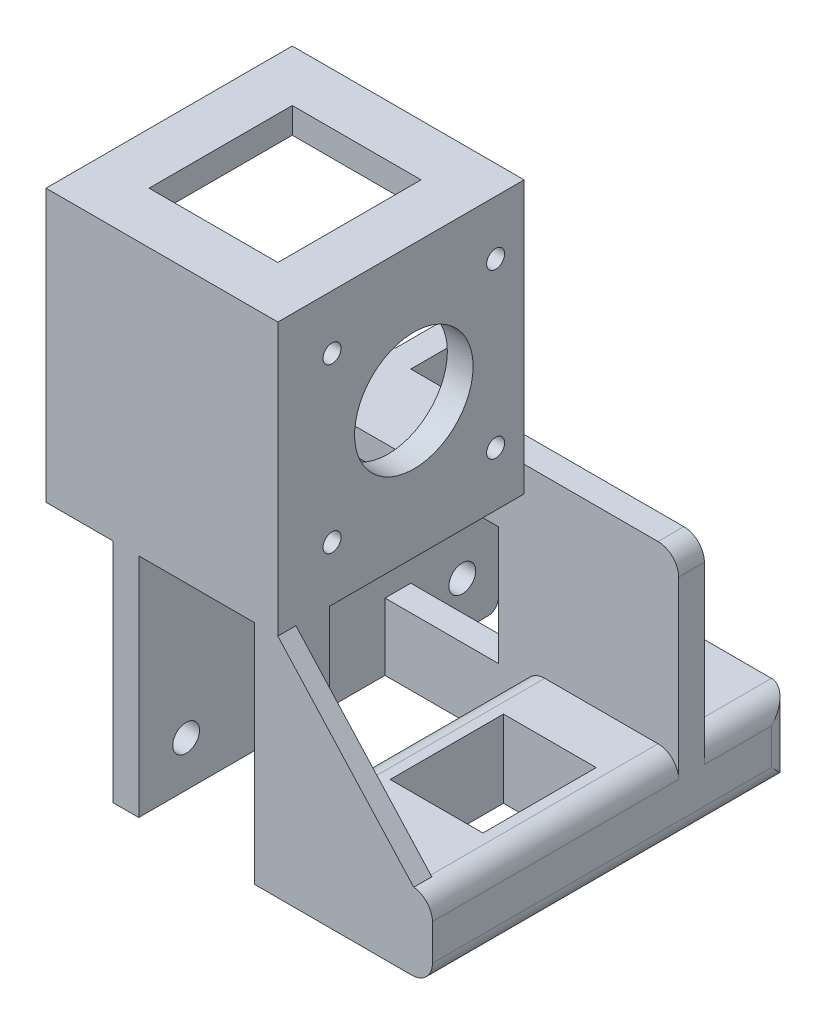
from build123d import *

# Parameters (mm, degrees)
SKETCH1_R            = 11
BOSS_EXTRUDE1_DEPTH  = 3
SKETCH2_R            = 5.25
CUT_EXTRUDE1_DEPTH   = 16.842979518
SKETCH3_R            = 1.5
SKETCH3_R_2          = 1.545696852
CUT_EXTRUDE2_DEPTH   = 16.842979518
SKETCH4_W            = 27.859055967
SKETCH4_H            = 2.012088195
BOSS_EXTRUDE3_DEPTH  = 11
SKETCH5_R            = 5.25
CUT_EXTRUDE3_DEPTH   = 31.019585245
SKETCH6_R            = 1.5
SKETCH6_R_2          = 1.545696852
CUT_EXTRUDE4_DEPTH   = 31.101943449
CUT_EXTRUDE5_DEPTH   = 10
BOSS_EXTRUDE5_START  = 5
SKETCH10_R           = 1.5
SKETCH10_R_2         = 5.25
SKETCH10_R_3         = 1.545696852
BOSS_EXTRUDE5_DEPTH  = 5
SKETCH11_W           = 18
SKETCH11_H           = 7.012088195
BOSS_EXTRUDE7_DEPTH  = 13
SKETCH13_W           = 6
SKETCH13_H           = 8
BOSS_EXTRUDE8_DEPTH  = 10
SKETCH14_W           = 18
SKETCH14_H           = 1.5
CUT_EXTRUDE6_DEPTH   = 10
SKETCH15_W           = 8
SKETCH15_H           = 8
BOSS_EXTRUDE9_DEPTH  = 30
SKETCH16_W           = 2
SKETCH16_H           = 8
BOSS_EXTRUDE10_DEPTH = 10
SKETCH18_W           = 47.012088195
SKETCH18_H           = 3.5
BOSS_EXTRUDE11_DEPTH = 8
SKETCH19_W           = 47.012088195
SKETCH19_H           = 5
BOSS_EXTRUDE12_DEPTH = 8
SKETCH20_R           = 2.75
CUT_EXTRUDE7_DEPTH   = 8
SKETCH21_W           = 30
SKETCH21_H           = 16.5
CUT_EXTRUDE8_DEPTH   = 8
BOSS_EXTRUDE13_DEPTH = 2
FILLET4_R            = 2
SKETCH24_W           = 18
SKETCH24_H           = 7.012088195
BOSS_EXTRUDE14_DEPTH = 13.5
SKETCH25_W           = 10.228009428
SKETCH25_H           = 18.5
BOSS_EXTRUDE15_DEPTH = 8
SKETCH26_R           = 2.6
CUT_EXTRUDE9_DEPTH   = 8
FILLET6_R            = 2
SKETCH27_W           = 8.492399871
SKETCH27_H           = 8.837619377
BOSS_EXTRUDE16_DEPTH = 8
SKETCH28_W           = 9.389970589
SKETCH28_H           = 7.249609645
BOSS_EXTRUDE17_DEPTH = 8
SKETCH30_W           = 8
SKETCH30_H           = 2
BOSS_EXTRUDE19_DEPTH = 8
SKETCH31_W           = 8
SKETCH31_H           = 2
BOSS_EXTRUDE20_DEPTH = 8
SKETCH32_W           = 8
SKETCH32_H           = 18.5
BOSS_EXTRUDE22_DEPTH = 5
SKETCH33_W           = 8
SKETCH33_H           = 18.5
BOSS_EXTRUDE23_DEPTH = 5
SKETCH34_R           = 2.6
CUT_EXTRUDE11_DEPTH  = 46.033658305
SKETCH35_R           = 2.6
CUT_EXTRUDE12_DEPTH  = 46.033658305
SKETCH36_W           = 8
SKETCH36_H           = 0.228009428
CUT_EXTRUDE13_DEPTH  = 57.389541409
SKETCH37_W           = 3
SKETCH37_H           = 18.5
CUT_EXTRUDE14_DEPTH  = 15
SKETCH38_W           = 3
SKETCH38_H           = 18.5
CUT_EXTRUDE15_DEPTH  = 15
FILLET9_R            = 2
SKETCH39_W           = 8.423355969
SKETCH39_H           = 9.735190095
SKETCH39_W_2         = 8.630487673
SKETCH39_H_2         = 8.354312067
BOSS_EXTRUDE24_DEPTH = 8
SKETCH40_R           = 2.6
CUT_EXTRUDE16_DEPTH  = 8
SKETCH41_W           = 3
SKETCH41_H           = 9.735190095
CUT_EXTRUDE18_DEPTH  = 9
SKETCH42_W           = 3
SKETCH42_H           = 8.354312067
CUT_EXTRUDE19_DEPTH  = 9
SKETCH43_R           = 2.6
CUT_EXTRUDE20_DEPTH  = 9
SKETCH48_W           = 22
SKETCH48_H           = 13
BOSS_EXTRUDE26_DEPTH = 5
SKETCH49_W           = 22
SKETCH49_H           = 13
BOSS_EXTRUDE27_DEPTH = 5
SKETCH50_W           = 5
SKETCH50_H           = 49
BOSS_EXTRUDE28_DEPTH = 15
SKETCH51_W           = 55
SKETCH51_H           = 5
BOSS_EXTRUDE29_DEPTH = 42.8
SKETCH52_W           = 55
SKETCH52_H           = 5
BOSS_EXTRUDE30_DEPTH = 47.8
SKETCH53_W           = 55
SKETCH53_H           = 5
BOSS_EXTRUDE31_DEPTH = 47.8
SKETCH55_W           = 15
SKETCH55_H           = 47.8
CUT_EXTRUDE21_DEPTH  = 128.298389621
SKETCH57_W           = 47.8
SKETCH57_H           = 52.8
BOSS_EXTRUDE32_DEPTH = 5
SKETCH58_R           = 11.5
CUT_EXTRUDE25_DEPTH  = 111.385370407
SKETCH61_W           = 25
SKETCH61_H           = 27.8
CUT_EXTRUDE26_DEPTH  = 128.298389621
SKETCH62_R           = 1.75
CUT_EXTRUDE28_DEPTH  = 108.656537191
SKETCH63_R           = 1.75
CUT_EXTRUDE29_DEPTH  = 108.656537191
SKETCH64_R           = 1.75
CUT_EXTRUDE30_DEPTH  = 108.656537191
SKETCH65_R           = 1.75
CUT_EXTRUDE31_DEPTH  = 108.656537191
SKETCH67_W           = 5
SKETCH67_H           = 49
BOSS_EXTRUDE33_DEPTH = 5
SKETCH68_W           = 15
SKETCH68_H           = 17.012088195
SKETCH68_H_2         = 47.8
BOSS_EXTRUDE34_DEPTH = 15
BOSS_EXTRUDE36_DEPTH = 15
SKETCH70_R           = 4.1
CUT_EXTRUDE32_DEPTH  = 10
SKETCH72_W           = 18
SKETCH72_H           = 22
CUT_EXTRUDE33_DEPTH  = 139.003188369
FILLET10_R           = 4
FILLET12_R           = 4
FILLET13_R           = 4
SKETCH74_W           = 4.5
SKETCH74_H           = 10
BOSS_EXTRUDE37_DEPTH = 50
SKETCH75_W           = 4.5
SKETCH75_H           = 10
BOSS_EXTRUDE38_DEPTH = 44.5
SKETCH76_W           = 10
SKETCH76_H           = 3.934778724
BOSS_EXTRUDE39_DEPTH = 14.5
SKETCH77_W           = 10
SKETCH77_H           = 4.5
BOSS_EXTRUDE42_DEPTH = 10
SKETCH78_W           = 10
SKETCH78_H           = 0.5
CUT_EXTRUDE34_DEPTH  = 10
BOSS_EXTRUDE43_DEPTH = 3.5
SKETCH81_W           = 5
SKETCH81_H           = 44
BOSS_EXTRUDE44_DEPTH = 47.8
SKETCH82_R           = 2.6
CUT_EXTRUDE36_DEPTH  = 7.8
SKETCH85_W           = 10
SKETCH85_H           = 44
CUT_EXTRUDE37_DEPTH  = 17.8
SKETCH90_W           = 6.956243517
SKETCH90_H           = 8.865800562
BOSS_EXTRUDE48_DEPTH = 5
SKETCH91_W           = 6.274258859
SKETCH91_H           = 6.956243518
SKETCH91_W_2         = 10.229769878
SKETCH91_H_2         = 10.502563742
SKETCH91_H_3         = 7.774625108
BOSS_EXTRUDE50_DEPTH = 5
SKETCH95_R           = 1.75
CUT_EXTRUDE41_DEPTH  = 5
SKETCH100_R          = 1.75
CUT_EXTRUDE42_DEPTH  = 5
SKETCH101_R          = 1.75
CUT_EXTRUDE43_DEPTH  = 5
SKETCH102_R          = 1.75
CUT_EXTRUDE44_DEPTH  = 5


with BuildPart() as part:
    # Sketch1 → Boss-Extrude1 (new body)
    with BuildSketch(Plane.XY):
        Circle(SKETCH1_R)
    extrude(amount=BOSS_EXTRUDE1_DEPTH)

    # Sketch2 → Cut-Extrude1 (cut, through all)
    with BuildSketch(Plane.XY.offset(3)):
        Circle(SKETCH2_R)
    extrude(amount=-CUT_EXTRUDE1_DEPTH, mode=Mode.SUBTRACT)

    # Sketch3 → Cut-Extrude2 (cut, through all)
    with BuildSketch(Plane.XY.offset(3)):
        with Locations((0, 8.5)):
            Circle(SKETCH3_R)
        with Locations((-8.5, 0)):
            Circle(SKETCH3_R)
        with Locations((0, -8.5)):
            Circle(SKETCH3_R_2)
        with Locations((8.5, 0)):
            Circle(SKETCH3_R)
    extrude(amount=-CUT_EXTRUDE2_DEPTH, mode=Mode.SUBTRACT)

    # Sketch4 → Boss-Extrude3 (add, symmetric)
    with BuildSketch(Plane(origin=(0, 0, 0), x_dir=(1, 0, 0), z_dir=(0, 1, 0))):
        with Locations((13.929527984, -1.993955902)):
            Rectangle(SKETCH4_W, SKETCH4_H)
    extrude(amount=BOSS_EXTRUDE3_DEPTH, both=True)

    # Sketch5 → Cut-Extrude3 (cut, through all)
    with BuildSketch(Plane(origin=(0, 0, 0.987911805), x_dir=(-1, 0, 0), z_dir=(0, 0, -1))):
        with Locations(Location((0, 0, 0), (0, 0, 180))):
            Circle(SKETCH5_R)
    extrude(amount=-CUT_EXTRUDE3_DEPTH, mode=Mode.SUBTRACT)

    # Sketch6 → Cut-Extrude4 (cut, through all)
    with BuildSketch(Plane(origin=(0, 0, 0), x_dir=(-1, 0, 0), z_dir=(0, 0, -1))):
        with Locations(Location((-8.5, 0, 0), (0, 0, 180))):
            Circle(SKETCH6_R)
        with Locations(Location((0, 8.5, 0), (0, 0, 180))):
            Circle(SKETCH6_R)
        with Locations(Location((0, -8.5, 0), (0, 0, 180))):
            Circle(SKETCH6_R_2)
    extrude(amount=-CUT_EXTRUDE4_DEPTH, mode=Mode.SUBTRACT)

    # Sketch7 → Cut-Extrude5 (cut)
    with BuildSketch(Plane(origin=(0, 0, 0.987911805), x_dir=(-1, 0, 0), z_dir=(0, 0, -1))):
        Polygon((-24, 11), (-27.859055967, 11), (-27.859055967, -11), (-24, -11), (-24, 0), align=None)
    extrude(amount=-CUT_EXTRUDE5_DEPTH, mode=Mode.SUBTRACT)

    # Sketch10 → Boss-Extrude5 (add)
    with BuildSketch(Plane.XY.offset(3).offset(BOSS_EXTRUDE5_START)):
        with BuildLine():
            Line((0, -11), (24, -11))
            Line((24, -11), (24, 11))
            Line((24, 11), (0, 11))
            ThreePointArc((0, 11), (-11, 0), (0, -11))
        make_face()
        with Locations((0, 8.5)):
            Circle(SKETCH10_R, mode=Mode.SUBTRACT)
        Circle(SKETCH10_R_2, mode=Mode.SUBTRACT)
        with Locations((0, -8.5)):
            Circle(SKETCH10_R_3, mode=Mode.SUBTRACT)
        with Locations((8.5, 0)):
            Circle(SKETCH10_R, mode=Mode.SUBTRACT)
        with Locations((-8.5, 0)):
            Circle(SKETCH10_R, mode=Mode.SUBTRACT)
    extrude(amount=-BOSS_EXTRUDE5_DEPTH)

    # Sketch11 → Boss-Extrude7 (add)
    with BuildSketch(Plane.XZ.offset(11)):
        with Locations((15, 4.493955902)):
            Rectangle(SKETCH11_W, SKETCH11_H)
    extrude(amount=BOSS_EXTRUDE7_DEPTH)

    # Sketch13 → Boss-Extrude8 (add)
    with BuildSketch(Plane(origin=(0, 0, 0.987911805), x_dir=(-1, 0, 0), z_dir=(0, 0, -1))):
        with Locations((-21, -18.5)):
            Rectangle(SKETCH13_W, SKETCH13_H)
    extrude(amount=BOSS_EXTRUDE8_DEPTH)

    # Sketch14 → Cut-Extrude6 (cut)
    with BuildSketch(Plane(origin=(0, 0, 0.987911805), x_dir=(-1, 0, 0), z_dir=(0, 0, -1))):
        with Locations((-15, -23.25)):
            Rectangle(SKETCH14_W, SKETCH14_H)
    extrude(amount=-CUT_EXTRUDE6_DEPTH, mode=Mode.SUBTRACT)

    # Sketch15 → Boss-Extrude9 (add)
    with BuildSketch(Plane.XY.offset(8)):
        with Locations((20, -18.5)):
            Rectangle(SKETCH15_W, SKETCH15_H)
    extrude(amount=BOSS_EXTRUDE9_DEPTH)

    # Sketch16 → Boss-Extrude10 (add)
    with BuildSketch(Plane(origin=(0, 0, 0.987911805), x_dir=(-1, 0, 0), z_dir=(0, 0, -1))):
        with Locations((-17, -18.5)):
            Rectangle(SKETCH16_W, SKETCH16_H)
    extrude(amount=BOSS_EXTRUDE10_DEPTH)

    # Sketch18 → Boss-Extrude11 (add)
    with BuildSketch(Plane(origin=(24, 0, 0), x_dir=(0, 0, -1), z_dir=(1, 0, 0))):
        with Locations((-14.493955902, -12.75)):
            Rectangle(SKETCH18_W, SKETCH18_H)
    extrude(amount=-BOSS_EXTRUDE11_DEPTH)

    # Sketch19 → Boss-Extrude12 (add)
    with BuildSketch(Plane(origin=(24, 0, 0), x_dir=(0, 0, -1), z_dir=(1, 0, 0))):
        with Locations((-14.493955902, -8.5)):
            Rectangle(SKETCH19_W, SKETCH19_H)
    extrude(amount=-BOSS_EXTRUDE12_DEPTH)

    # Sketch20 → Cut-Extrude7 (cut)
    with BuildSketch(Plane(origin=(24, 0, 0), x_dir=(0, 0, -1), z_dir=(1, 0, 0))):
        with Locations((2.797809472, -17)):
            Circle(SKETCH20_R)
    extrude(amount=-CUT_EXTRUDE7_DEPTH, mode=Mode.SUBTRACT)

    # Sketch21 → Cut-Extrude8 (cut)
    with BuildSketch(Plane(origin=(24, 0, 0), x_dir=(0, 0, -1), z_dir=(1, 0, 0))):
        with Locations((-23, -14.25)):
            Rectangle(SKETCH21_W, SKETCH21_H)
    extrude(amount=-CUT_EXTRUDE8_DEPTH, mode=Mode.SUBTRACT)

    # Sketch22 → Boss-Extrude13 (add)
    with BuildSketch(Plane.XZ.offset(22.5)):
        Polygon((6, 8), (24, 8), (24, -9.012088195), (16, -9.012088195), (16, 0.987911805), (6, 0.987911805), align=None)
    extrude(amount=BOSS_EXTRUDE13_DEPTH)

    # Fillet4
    fillet4_edges = [part.edges().sort_by_distance(p)[0] for p in [
        (20, -6, -9.012088195),
        (20, -24.5, -9.012088195),
    ]]
    fillet(fillet4_edges, radius=FILLET4_R)

    # Sketch24 → Boss-Extrude14 (add)
    with BuildSketch(Plane(origin=(0, 11, 0), x_dir=(1, 0, 0), z_dir=(0, 1, 0))):
        with Locations((15, -4.493955902)):
            Rectangle(SKETCH24_W, SKETCH24_H)
    extrude(amount=BOSS_EXTRUDE14_DEPTH)

    # Sketch25 → Boss-Extrude15 (add)
    with BuildSketch(Plane(origin=(24, 0, 0), x_dir=(0, 0, -1), z_dir=(1, 0, 0))):
        with Locations((4.126092909, 15.25)):
            Rectangle(SKETCH25_W, SKETCH25_H)
    extrude(amount=-BOSS_EXTRUDE15_DEPTH)

    # Sketch26 → Cut-Extrude9 (cut)
    with BuildSketch(Plane(origin=(24, 0, 0), x_dir=(0, 0, -1), z_dir=(1, 0, 0))):
        with Locations((2.797809472, 17)):
            Circle(SKETCH26_R)
    extrude(amount=-CUT_EXTRUDE9_DEPTH, mode=Mode.SUBTRACT)

    # Fillet6
    fillet6_edges = [part.edges().sort_by_distance(p)[0] for p in [
        (20, 24.5, -9.240097623),
        (20, 6, -9.240097623),
    ]]
    fillet(fillet6_edges, radius=FILLET6_R)

    # Sketch27 → Boss-Extrude16 (add)
    with BuildSketch(Plane(origin=(24, 0, 0), x_dir=(0, 0, -1), z_dir=(1, 0, 0))):
        with Locations((2.277102445, 17.019321692)):
            Rectangle(SKETCH27_W, SKETCH27_H)
    extrude(amount=-BOSS_EXTRUDE16_DEPTH)

    # Sketch28 → Boss-Extrude17 (add)
    with BuildSketch(Plane(origin=(24, 0, 0), x_dir=(0, 0, -1), z_dir=(1, 0, 0))):
        with Locations((2.173536592, -16.501492431)):
            Rectangle(SKETCH28_W, SKETCH28_H)
    extrude(amount=-BOSS_EXTRUDE17_DEPTH)

    # Sketch30 → Boss-Extrude19 (add)
    with BuildSketch(Plane(origin=(0, 0, -9.240097623), x_dir=(-1, 0, 0), z_dir=(0, 0, -1))):
        with Locations((-20, 23.5)):
            Rectangle(SKETCH30_W, SKETCH30_H)
        with Locations((-20, 7)):
            Rectangle(SKETCH30_W, SKETCH30_H)
    extrude(amount=-BOSS_EXTRUDE19_DEPTH)

    # Sketch31 → Boss-Extrude20 (add)
    with BuildSketch(Plane(origin=(0, 0, -9.012088195), x_dir=(-1, 0, 0), z_dir=(0, 0, -1))):
        with Locations((-20, -7)):
            Rectangle(SKETCH31_W, SKETCH31_H)
        with Locations((-20, -23.5)):
            Rectangle(SKETCH31_W, SKETCH31_H)
    extrude(amount=-BOSS_EXTRUDE20_DEPTH)

    # Sketch32 → Boss-Extrude22 (add)
    with BuildSketch(Plane(origin=(0, 0, -9.240097623), x_dir=(-1, 0, 0), z_dir=(0, 0, -1))):
        with Locations((-20, 15.25)):
            Rectangle(SKETCH32_W, SKETCH32_H)
    extrude(amount=BOSS_EXTRUDE22_DEPTH)

    # Sketch33 → Boss-Extrude23 (add)
    with BuildSketch(Plane(origin=(0, 0, -9.012088195), x_dir=(-1, 0, 0), z_dir=(0, 0, -1))):
        with Locations((-20, -15.25)):
            Rectangle(SKETCH33_W, SKETCH33_H)
    extrude(amount=BOSS_EXTRUDE23_DEPTH)

    # Sketch34 → Cut-Extrude11 (cut, through all)
    with BuildSketch(Plane(origin=(24, 0, 0), x_dir=(0, 0, -1), z_dir=(1, 0, 0))):
        with Locations((6.012088195, 16.7)):
            Circle(SKETCH34_R)
    extrude(amount=-CUT_EXTRUDE11_DEPTH, mode=Mode.SUBTRACT)

    # Sketch35 → Cut-Extrude12 (cut, through all)
    with BuildSketch(Plane(origin=(24, 0, 0), x_dir=(0, 0, -1), z_dir=(1, 0, 0))):
        with Locations((6.012088195, -16.7)):
            Circle(SKETCH35_R)
    extrude(amount=-CUT_EXTRUDE12_DEPTH, mode=Mode.SUBTRACT)

    # Sketch36 → Cut-Extrude13 (cut, through all)
    with BuildSketch(Plane.XZ.offset(24.5)):
        with Locations((20, -14.126092909)):
            Rectangle(SKETCH36_W, SKETCH36_H)
    extrude(amount=-CUT_EXTRUDE13_DEPTH, mode=Mode.SUBTRACT)

    # Sketch37 → Cut-Extrude14 (cut)
    with BuildSketch(Plane(origin=(0, 0, -14.012088195), x_dir=(-1, 0, 0), z_dir=(0, 0, -1))):
        with Locations((-17.5, -15.25)):
            Rectangle(SKETCH37_W, SKETCH37_H)
    extrude(amount=-CUT_EXTRUDE14_DEPTH, mode=Mode.SUBTRACT)

    # Sketch38 → Cut-Extrude15 (cut)
    with BuildSketch(Plane(origin=(0, 0, -14.012088195), x_dir=(-1, 0, 0), z_dir=(0, 0, -1))):
        with Locations((-17.5, 15.25)):
            Rectangle(SKETCH38_W, SKETCH38_H)
    extrude(amount=-CUT_EXTRUDE15_DEPTH, mode=Mode.SUBTRACT)

    # Fillet9
    fillet9_edges = [part.edges().sort_by_distance(p)[0] for p in [
        (21.5, -24.5, -14.012088195),
        (21.5, 6, -14.012088195),
        (21.5, 24.5, -14.012088195),
        (21.5, -6, -14.012088195),
    ]]
    fillet(fillet9_edges, radius=FILLET9_R)

    # Sketch39 → Boss-Extrude24 (add)
    with BuildSketch(Plane(origin=(24, 0, 0), x_dir=(0, 0, -1), z_dir=(1, 0, 0))):
        with Locations((6.768936723, 16.708624135)):
            Rectangle(SKETCH39_W, SKETCH39_H)
        with Locations((6.11301966, -16.846711938)):
            Rectangle(SKETCH39_W_2, SKETCH39_H_2)
    extrude(amount=-BOSS_EXTRUDE24_DEPTH)

    # Sketch40 → Cut-Extrude16 (cut)
    with BuildSketch(Plane(origin=(24, 0, 0), x_dir=(0, 0, -1), z_dir=(1, 0, 0))):
        with Locations((7, 15.7)):
            Circle(SKETCH40_R)
    extrude(amount=-CUT_EXTRUDE16_DEPTH, mode=Mode.SUBTRACT)

    # Sketch41 → Cut-Extrude18 (cut)
    with BuildSketch(Plane(origin=(0, 0, -10.980614707), x_dir=(-1, 0, 0), z_dir=(0, 0, -1))):
        with Locations((-17.5, 16.708624135)):
            Rectangle(SKETCH41_W, SKETCH41_H)
    extrude(amount=-CUT_EXTRUDE18_DEPTH, mode=Mode.SUBTRACT)

    # Sketch42 → Cut-Extrude19 (cut)
    with BuildSketch(Plane(origin=(0, 0, -10.428263496), x_dir=(-1, 0, 0), z_dir=(0, 0, -1))):
        with Locations((-17.5, -16.846711938)):
            Rectangle(SKETCH42_W, SKETCH42_H)
    extrude(amount=-CUT_EXTRUDE19_DEPTH, mode=Mode.SUBTRACT)

    # Sketch43 → Cut-Extrude20 (cut)
    with BuildSketch(Plane(origin=(24, 0, 0), x_dir=(0, 0, -1), z_dir=(1, 0, 0))):
        with Locations((7, -15.7)):
            Circle(SKETCH43_R)
    extrude(amount=-CUT_EXTRUDE20_DEPTH, mode=Mode.SUBTRACT)

    # Sketch48 → Boss-Extrude26 (add)
    with BuildSketch(Plane.XY.offset(8)):
        with Locations((35, -18)):
            Rectangle(SKETCH48_W, SKETCH48_H)
    extrude(amount=-BOSS_EXTRUDE26_DEPTH)

    # Sketch49 → Boss-Extrude27 (add)
    with BuildSketch(Plane.XY.offset(8)):
        with Locations((35, 18)):
            Rectangle(SKETCH49_W, SKETCH49_H)
    extrude(amount=-BOSS_EXTRUDE27_DEPTH)

    # Sketch50 → Boss-Extrude28 (add)
    with BuildSketch(Plane(origin=(46, 0, 0), x_dir=(0, 0, -1), z_dir=(1, 0, 0))):
        with Locations((-5.5, 0)):
            Rectangle(SKETCH50_W, SKETCH50_H)
    extrude(amount=BOSS_EXTRUDE28_DEPTH)

    # Sketch51 → Boss-Extrude29 (add)
    with BuildSketch(Plane.XY.offset(8)):
        with Locations((33.5, 22)):
            Rectangle(SKETCH51_W, SKETCH51_H)
    extrude(amount=BOSS_EXTRUDE29_DEPTH)

    # Sketch52 → Boss-Extrude30 (add)
    with BuildSketch(Plane.XZ.offset(-19.5)):
        with Locations((33.5, 53.3)):
            Rectangle(SKETCH52_W, SKETCH52_H)
    extrude(amount=-BOSS_EXTRUDE30_DEPTH)

    # Sketch53 → Boss-Extrude31 (add)
    with BuildSketch(Plane.XY.offset(55.8)):
        with Locations((33.5, 69.8)):
            Rectangle(SKETCH53_W, SKETCH53_H)
    extrude(amount=-BOSS_EXTRUDE31_DEPTH)

    # Sketch55 → Cut-Extrude21 (cut, through all)
    with BuildSketch(Plane(origin=(0, 72.3, 0), x_dir=(1, 0, 0), z_dir=(0, 1, 0))):
        with Locations((53.5, -31.9)):
            Rectangle(SKETCH55_W, SKETCH55_H)
    extrude(amount=-CUT_EXTRUDE21_DEPTH, mode=Mode.SUBTRACT)

    # Sketch57 → Boss-Extrude32 (add)
    with BuildSketch(Plane(origin=(46, 0, 0), x_dir=(0, 0, -1), z_dir=(1, 0, 0))):
        with Locations((-31.9, 45.9)):
            Rectangle(SKETCH57_W, SKETCH57_H)
    extrude(amount=BOSS_EXTRUDE32_DEPTH)

    # Sketch58 → Cut-Extrude25 (cut, through all)
    with BuildSketch(Plane(origin=(51, 0, 0), x_dir=(0, 0, -1), z_dir=(1, 0, 0))):
        with Locations((-29.4, 45.9)):
            Circle(SKETCH58_R)
    extrude(amount=-CUT_EXTRUDE25_DEPTH, mode=Mode.SUBTRACT)

    # Sketch61 → Cut-Extrude26 (cut, through all)
    with BuildSketch(Plane(origin=(0, 72.3, 0), x_dir=(1, 0, 0), z_dir=(0, 1, 0))):
        with Locations((28.5, -31.9)):
            Rectangle(SKETCH61_W, SKETCH61_H)
    extrude(amount=-CUT_EXTRUDE26_DEPTH, mode=Mode.SUBTRACT)

    # Sketch62 → Cut-Extrude28 (cut, through all)
    with BuildSketch(Plane.ZY.offset(-46)):
        with Locations((46.3, 29)):
            Circle(SKETCH62_R)
    extrude(amount=-CUT_EXTRUDE28_DEPTH, mode=Mode.SUBTRACT)

    # Sketch63 → Cut-Extrude29 (cut, through all)
    with BuildSketch(Plane.ZY.offset(-46)):
        with Locations((12.5, 29)):
            Circle(SKETCH63_R)
    extrude(amount=-CUT_EXTRUDE29_DEPTH, mode=Mode.SUBTRACT)

    # Sketch64 → Cut-Extrude30 (cut, through all)
    with BuildSketch(Plane.ZY.offset(-46)):
        with Locations((46.3, 62.8)):
            Circle(SKETCH64_R)
    extrude(amount=-CUT_EXTRUDE30_DEPTH, mode=Mode.SUBTRACT)

    # Sketch65 → Cut-Extrude31 (cut, through all)
    with BuildSketch(Plane.ZY.offset(-46)):
        with Locations((12.5, 62.8)):
            Circle(SKETCH65_R)
    extrude(amount=-CUT_EXTRUDE31_DEPTH, mode=Mode.SUBTRACT)

    # Sketch67 → Boss-Extrude33 (add)
    with BuildSketch(Plane(origin=(61, 0, 0), x_dir=(0, 0, -1), z_dir=(1, 0, 0))):
        with Locations((-5.5, 0)):
            Rectangle(SKETCH67_W, SKETCH67_H)
    extrude(amount=BOSS_EXTRUDE33_DEPTH)

    # Sketch68 → Boss-Extrude34 (add)
    with BuildSketch(Plane.XZ.offset(24.5)):
        with Locations((58.5, -5.506044098)):
            Rectangle(SKETCH68_W, SKETCH68_H)
        with Locations((58.5, 31.9)):
            Rectangle(SKETCH68_W, SKETCH68_H_2)
    extrude(amount=-BOSS_EXTRUDE34_DEPTH)

    # Sketch69 → Boss-Extrude36 (add)
    with BuildSketch(Plane(origin=(66, 0, 0), x_dir=(0, 0, -1), z_dir=(1, 0, 0))):
        Polygon((-55.8, -9.5), (-8, -9.5), (-8, 24.5), (-3, 24.5), (-3, -9.5), (14.012088195, -9.5), (14.012088195, -24.5), (-55.8, -24.5), align=None)
    extrude(amount=BOSS_EXTRUDE36_DEPTH)

    # Sketch70 → Cut-Extrude32 (cut)
    with BuildSketch(Plane.XZ.offset(24.5)):
        with Locations(Location((66, 47.8, 0), (0, 0, 270))):
            Circle(SKETCH70_R)
        with Locations(Location((66, -6.012088195, 0), (0, 0, 270))):
            Circle(SKETCH70_R)
    extrude(amount=-CUT_EXTRUDE32_DEPTH, mode=Mode.SUBTRACT)

    # Sketch72 → Cut-Extrude33 (cut, through all)
    with BuildSketch(Plane.XZ.offset(24.5)):
        with Locations((66, 29)):
            Rectangle(SKETCH72_W, SKETCH72_H)
    extrude(amount=-CUT_EXTRUDE33_DEPTH, mode=Mode.SUBTRACT)

    # Fillet10
    fillet10_edges = [part.edges().sort_by_distance(p)[0] for p in [
        (81, 24.5, 5.5),
    ]]
    fillet(fillet10_edges, radius=FILLET10_R)

    # Fillet12
    fillet12_edges = [part.edges().sort_by_distance(p)[0] for p in [
        (6, -24.5, 4.493955903),
    ]]
    fillet(fillet12_edges, radius=FILLET12_R)

    # Fillet13
    fillet13_edges = [part.edges().sort_by_distance(p)[0] for p in [
        (51, -9.5, -5.506044097),
        (51, -17, -14.012088195),
        (51, -24.5, -5.506044097),
        (51, -9.5, 31.9),
        (51, -24.5, 31.9),
        (81, -24.5, 20.893955903),
        (81, -17, -14.012088195),
        (81, -9.5, -5.506044097),
        (81, -9.5, 31.9),
    ]]
    fillet(fillet13_edges, radius=FILLET13_R)

    # Sketch74 → Boss-Extrude37 (add)
    with BuildSketch(Plane(origin=(0, -24.5, 0), x_dir=(-1, 0, 0), z_dir=(0, -1, 0))):
        with Locations((-48.75, -50.8)):
            Rectangle(SKETCH74_W, SKETCH74_H)
    extrude(amount=-BOSS_EXTRUDE37_DEPTH)

    # Sketch75 → Boss-Extrude38 (add)
    with BuildSketch(Plane.XZ.offset(-19.5)):
        with Locations((48.75, 30.8)):
            Rectangle(SKETCH75_W, SKETCH75_H)
    extrude(amount=BOSS_EXTRUDE38_DEPTH)

    # Sketch76 → Boss-Extrude39 (add)
    with BuildSketch(Plane.ZY.offset(-46.5)):
        with Locations((50.8, -22.532610638)):
            Rectangle(SKETCH76_W, SKETCH76_H)
    extrude(amount=-BOSS_EXTRUDE39_DEPTH)

    # Sketch77 → Boss-Extrude42 (add)
    with BuildSketch(Plane.ZY.offset(-46.5)):
        with Locations((30.8, -22.75)):
            Rectangle(SKETCH77_W, SKETCH77_H)
    extrude(amount=-BOSS_EXTRUDE42_DEPTH)

    # Sketch78 → Cut-Extrude34 (cut)
    with BuildSketch(Plane.XY.offset(35.8)):
        with Locations((51.5, -24.75)):
            Rectangle(SKETCH78_W, SKETCH78_H)
    extrude(amount=-CUT_EXTRUDE34_DEPTH, mode=Mode.SUBTRACT)

    # Sketch79 → Boss-Extrude43 (add)
    with BuildSketch(Plane.XY.offset(55.8)):
        Polygon((51, -13.5), (51, 19.5), (81, -13.5), align=None)
    extrude(amount=-BOSS_EXTRUDE43_DEPTH)

    # Sketch81 → Boss-Extrude44 (add)
    with BuildSketch(Plane.XY.offset(8)):
        with Locations((21.5, -2.5)):
            Rectangle(SKETCH81_W, SKETCH81_H)
    extrude(amount=BOSS_EXTRUDE44_DEPTH)

    # Sketch82 → Cut-Extrude36 (cut)
    with BuildSketch(Plane.ZY.offset(-19)):
        with Locations(Location((30.8, 15.7, 0), (0, 0, 270))):
            Circle(SKETCH82_R)
        with Locations(Location((46.604777531, -15.7, 0), (0, 0, 270))):
            Circle(SKETCH82_R)
    extrude(amount=-CUT_EXTRUDE36_DEPTH, mode=Mode.SUBTRACT)

    # Sketch85 → Cut-Extrude37 (cut)
    with BuildSketch(Plane(origin=(51, 0, 0), x_dir=(0, 0, -1), z_dir=(1, 0, 0))):
        with Locations((-30.8, -2.5)):
            Rectangle(SKETCH85_W, SKETCH85_H)
    extrude(amount=-CUT_EXTRUDE37_DEPTH, mode=Mode.SUBTRACT)

    # Sketch90 → Boss-Extrude48 (add)
    with BuildSketch(Plane(origin=(51, 0, 0), x_dir=(0, 0, -1), z_dir=(1, 0, 0))):
        with Locations((-12.846536932, 62.90952247)):
            Rectangle(SKETCH90_W, SKETCH90_H)
    extrude(amount=-BOSS_EXTRUDE48_DEPTH)

    # Sketch91 → Boss-Extrude50 (add)
    with BuildSketch(Plane(origin=(51, 0, 0), x_dir=(0, 0, -1), z_dir=(1, 0, 0))):
        with Locations((-47.423159121, 63.045919402)):
            Rectangle(SKETCH91_W, SKETCH91_H)
        with Locations((-45.445403611, 29.628671132)):
            Rectangle(SKETCH91_W_2, SKETCH91_H_2)
        with Locations((-13.18752926, 29.628671132)):
            Rectangle(SKETCH91_W, SKETCH91_H_3)
    extrude(amount=-BOSS_EXTRUDE50_DEPTH)

    # Sketch95 → Cut-Extrude41 (cut)
    with BuildSketch(Plane(origin=(51, 0, 0), x_dir=(0, 0, -1), z_dir=(1, 0, 0))):
        with Locations((-13.525452762, 61.774547238)):
            Circle(SKETCH95_R)
    extrude(amount=-CUT_EXTRUDE41_DEPTH, mode=Mode.SUBTRACT)

    # Sketch100 → Cut-Extrude42 (cut)
    with BuildSketch(Plane(origin=(51, 0, 0), x_dir=(0, 0, -1), z_dir=(1, 0, 0))):
        with Locations((-45.274547238, 61.774547238)):
            Circle(SKETCH100_R)
    extrude(amount=-CUT_EXTRUDE42_DEPTH, mode=Mode.SUBTRACT)

    # Sketch101 → Cut-Extrude43 (cut)
    with BuildSketch(Plane(origin=(51, 0, 0), x_dir=(0, 0, -1), z_dir=(1, 0, 0))):
        with Locations((-13.525452762, 30.025452762)):
            Circle(SKETCH101_R)
    extrude(amount=-CUT_EXTRUDE43_DEPTH, mode=Mode.SUBTRACT)

    # Sketch102 → Cut-Extrude44 (cut)
    with BuildSketch(Plane(origin=(51, 0, 0), x_dir=(0, 0, -1), z_dir=(1, 0, 0))):
        with Locations((-45.274547238, 30.025452762)):
            Circle(SKETCH102_R)
    extrude(amount=-CUT_EXTRUDE44_DEPTH, mode=Mode.SUBTRACT)


solid = part.part
